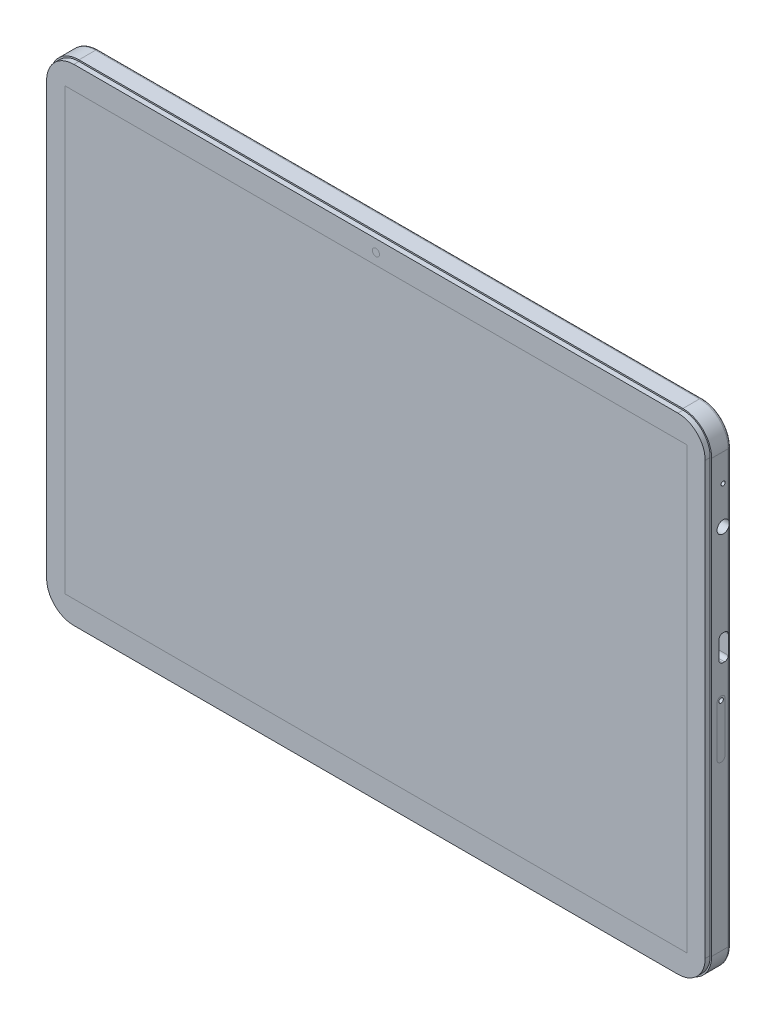
from build123d import *

# Parameters (mm, degrees)
SKETCH1_W           = 230
SKETCH1_H           = 170
BOSS_EXTRUDE1_DEPTH = 8.5
FILLET1_R           = 10
FILLET2_R           = 1
CUT_EXTRUDE1_DEPTH  = 7.2
SKETCH9_R           = 2.143665007
SKETCH9_R_2         = 0.701539988
SKETCH9_R_3         = 0.777758638
CUT_EXTRUDE2_DEPTH  = 7
CUT_EXTRUDE3_DEPTH  = 1.75
BOSS_EXTRUDE2_DEPTH = 0.7
SKETCH16_R          = 4
CUT_EXTRUDE4_DEPTH  = 1
SCALE2_SCALE        = 0.75


# Read off the part's stored shape, not the designer's step: Dome1
with BuildPart() as part:
    # Sketch1 → Boss-Extrude1 (new body)
    with BuildSketch(Plane.XY):
        Rectangle(SKETCH1_W, SKETCH1_H)
    extrude(amount=BOSS_EXTRUDE1_DEPTH)

    # Fillet1
    fillet1_edges = [part.edges().sort_by_distance(p)[0] for p in [
        (115, -85, 4.25),
        (-115, -85, 4.25),
        (-115, 85, 4.25),
        (115, 85, 4.25),
    ]]
    fillet(fillet1_edges, radius=FILLET1_R)

    # Fillet2
    fillet2_edges = [part.edges().sort_by_distance(p)[0] for p in [
        (115, 0, 0),
        (0, -85, 0),
        (-115, 0, 0),
        (0, 85, 0),
        (-112.071067812, 82.071067812, 0),
        (112.071067812, 82.071067812, 0),
        (-112.071067812, -82.071067812, 0),
        (112.071067812, -82.071067812, 0),
    ]]
    fillet(fillet2_edges, radius=FILLET2_R)

    # Sketch8 → Cut-Extrude1 (cut)
    with BuildSketch(Plane(origin=(115, 0, 0), x_dir=(0, 0, -1), z_dir=(1, 0, 0))):
        with BuildLine():
            Line((-0.980286153, 19.184203106), (-0.980286153, 12.784203106))
            ThreePointArc((-0.980286153, 12.784203106), (-1.358118405, 11.872035358), (-2.270286153, 11.494203106))
            Line((-2.270286153, 11.494203106), (-2.880286153, 11.494203106))
            ThreePointArc((-2.880286153, 11.494203106), (-3.7924539, 11.872035358), (-4.170286153, 12.784203106))
            Line((-4.170286153, 12.784203106), (-4.170286153, 19.184203106))
            ThreePointArc((-4.170286153, 19.184203106), (-3.7924539, 20.096370853), (-2.880286153, 20.474203106))
            Line((-2.880286153, 20.474203106), (-2.270286153, 20.474203106))
            ThreePointArc((-2.270286153, 20.474203106), (-1.358118405, 20.096370853), (-0.980286153, 19.184203106))
        make_face()
    extrude(amount=-CUT_EXTRUDE1_DEPTH, mode=Mode.SUBTRACT)

    # Sketch9 → Cut-Extrude2 (cut)
    with BuildSketch(Plane(origin=(115, 0, 0), x_dir=(0, 0, -1), z_dir=(1, 0, 0))):
        with Locations((-2.726268546, 52.363224928)):
            Circle(SKETCH9_R)
        with Locations((-2.774318312, 65.416854758)):
            Circle(SKETCH9_R_2)
        with Locations((-3.459851421, 0.420212385)):
            Circle(SKETCH9_R_3)
    extrude(amount=-CUT_EXTRUDE2_DEPTH, mode=Mode.SUBTRACT)

    # Sketch11 → Cut-Extrude3 (cut)
    with BuildSketch(Plane.XY.offset(8.5)):
        with BuildLine():
            Line((-105, -85), (105, -85))
            ThreePointArc((105, -85), (112.071067812, -82.071067812), (115, -75))
            Line((115, -75), (115, 75))
            ThreePointArc((115, 75), (112.071067812, 82.071067812), (105, 85))
            Line((105, 85), (-105, 85))
            ThreePointArc((-105, 85), (-112.071067812, 82.071067812), (-115, 75))
            Line((-115, 75), (-115, -75))
            ThreePointArc((-115, -75), (-112.071067812, -82.071067812), (-105, -85))
        make_face()
        with BuildLine():
            Line((-105, -84.5), (105, -84.5))
            ThreePointArc((105, -84.5), (111.717514421, -81.717514421), (114.5, -75))
            Line((114.5, -75), (114.5, 75))
            ThreePointArc((114.5, 75), (111.717514421, 81.717514421), (105, 84.5))
            Line((105, 84.5), (-105, 84.5))
            ThreePointArc((-105, 84.5), (-111.717514421, 81.717514421), (-114.5, 75))
            Line((-114.5, 75), (-114.5, -75))
            ThreePointArc((-114.5, -75), (-111.717514421, -81.717514421), (-105, -84.5))
        make_face(mode=Mode.SUBTRACT)
    extrude(amount=-CUT_EXTRUDE3_DEPTH, mode=Mode.SUBTRACT)

    # Sketch13<3> → Boss-Extrude2 (add)
    with BuildSketch(Plane.ZY.offset(115)):
        with BuildLine():
            Line((4.85, 29.258026972), (4.85, 19.158026972))
            ThreePointArc((4.85, 19.158026972), (3.95, 18.258026972), (3.05, 19.158026972))
            Line((3.05, 19.158026972), (3.05, 29.258026972))
            ThreePointArc((3.05, 29.258026972), (3.95, 30.158026972), (4.85, 29.258026972))
        make_face()
        with BuildLine():
            Line((4.85, 61.358026972), (4.85, 43.158026972))
            ThreePointArc((4.85, 43.158026972), (3.95, 42.258026972), (3.05, 43.158026972))
            Line((3.05, 43.158026972), (3.05, 61.358026972))
            ThreePointArc((3.05, 61.358026972), (3.95, 62.258026972), (4.85, 61.358026972))
        make_face()
    extrude(amount=BOSS_EXTRUDE2_DEPTH)

    # Sketch16 → Cut-Extrude4 (cut)
    with BuildSketch(Plane(origin=(0, 0, 0), x_dir=(-1, 0, 0), z_dir=(0, 0, -1))):
        with Locations((96, 74)):
            Circle(SKETCH16_R)
    extrude(amount=-CUT_EXTRUDE4_DEPTH, mode=Mode.SUBTRACT)

    # Dome1 outline → Dome1 (revolve)
    with BuildSketch(Plane(origin=(-96, 74, 0), x_dir=(1, 0, 0), z_dir=(0, -1, 0))):
        with BuildLine():
            Line((0, 1.000000002), (0, 0))
            ThreePointArc((0, 0), (0.90138782, 0.272918272), (1.500000001, 1.000000002))
            Line((1.500000001, 1.000000002), (0, 1.000000002))
        make_face()
    revolve(axis=Axis((-96, 74, 0), (0, 0, 1)))


with BuildPart() as part_1:
    # Scale2: scaled about (-0.108567149, -0.033027208, 4.247091052)
    add(part.part.scale(SCALE2_SCALE).moved(Location((-0.027141787, -0.008256802, 1.061772763))))


solid = part_1.part
